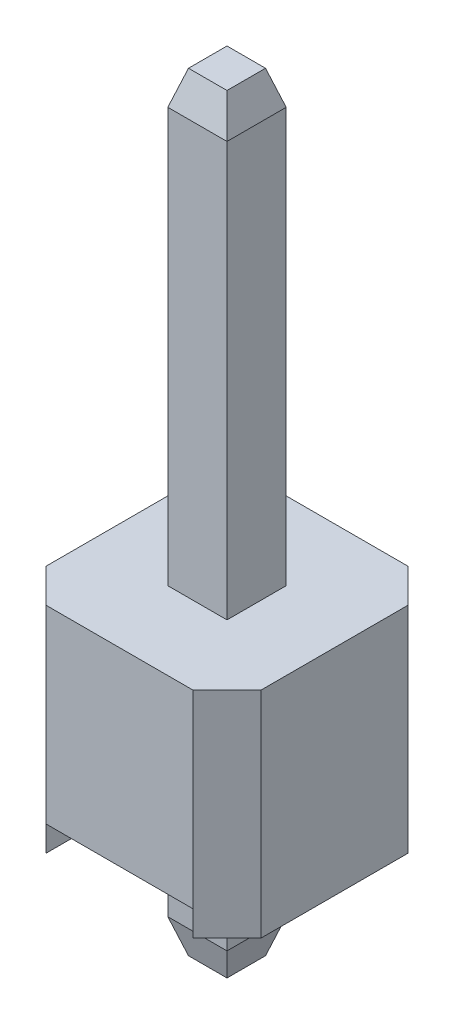
from build123d import *
from OCP.BRepFilletAPI import BRepFilletAPI_MakeChamfer

# Parameters (mm, degrees)
SKETCH1_W           = 2.54
SKETCH1_H           = 2.54
BOSS_EXTRUDE1_DEPTH = 2.54
CHAMFER1_SIZE       = 0.4
SKETCH2_W           = 1.74
SKETCH2_H           = 2.54
CUT_EXTRUDE1_DEPTH  = 0.3
SKETCH3_W           = 0.7
SKETCH3_H           = 0.7
BOSS_EXTRUDE2_DEPTH = 5.3
SKETCH4_W           = 0.7
SKETCH4_H           = 0.7
BOSS_EXTRUDE3_DEPTH = 1.55
CHAMFER2_SIZE       = 0.4
CHAMFER2_SIZE2      = 0.122292273


with BuildPart() as part:
    # Sketch1 → Boss-Extrude1 (new body)
    with BuildSketch(Plane(origin=(0, 0, 0), x_dir=(1, 0, 0), z_dir=(0, 1, 0))):
        Rectangle(SKETCH1_W, SKETCH1_H)
    extrude(amount=BOSS_EXTRUDE1_DEPTH)

    # Chamfer1
    chamfer1_edges = [part.edges().sort_by_distance(p)[0] for p in [
        (-1.27, 1.27, -1.27),
        (1.27, 1.27, -1.27),
        (-1.27, 1.27, 1.27),
        (1.27, 1.27, 1.27),
    ]]
    chamfer(chamfer1_edges, length=CHAMFER1_SIZE)

    # Sketch2 → Cut-Extrude1 (cut)
    with BuildSketch(Plane.XZ):
        Rectangle(SKETCH2_W, SKETCH2_H)
    extrude(amount=-CUT_EXTRUDE1_DEPTH, mode=Mode.SUBTRACT)

    # Sketch3 → Boss-Extrude2 (add)
    with BuildSketch(Plane(origin=(0, 2.54, 0), x_dir=(1, 0, 0), z_dir=(0, 1, 0))):
        Rectangle(SKETCH3_W, SKETCH3_H)
    extrude(amount=BOSS_EXTRUDE2_DEPTH)

    # Sketch4 → Boss-Extrude3 (add)
    with BuildSketch(Plane.XZ.offset(-0.3)):
        Rectangle(SKETCH4_W, SKETCH4_H)
    extrude(amount=BOSS_EXTRUDE3_DEPTH)

    # Chamfer2: one chamfer whose edges measure the first distance from different faces: ONE call of the kernel's chamfer builder (chamfer() names one face for all edges)
    chamfer2_edges_1 = [part.edges().sort_by_distance(p)[0] for p in [
        (0, 7.84, -0.35),
    ]]
    chamfer2_side_1 = [part.faces().sort_by_distance(p)[0] for p in [
        (0, 5.19, -0.35),
    ]]
    chamfer2_edges_2 = [part.edges().sort_by_distance(p)[0] for p in [
        (-0.35, 7.84, 0),
    ]]
    chamfer2_side_2 = [part.faces().sort_by_distance(p)[0] for p in [
        (-0.35, 5.19, 0),
    ]]
    chamfer2_edges_3 = [part.edges().sort_by_distance(p)[0] for p in [
        (0.35, 7.84, 0),
    ]]
    chamfer2_side_3 = [part.faces().sort_by_distance(p)[0] for p in [
        (0.35, 5.19, 0),
    ]]
    chamfer2_edges_4 = [part.edges().sort_by_distance(p)[0] for p in [
        (0, 7.84, 0.35),
    ]]
    chamfer2_side_4 = [part.faces().sort_by_distance(p)[0] for p in [
        (0, 5.19, 0.35),
    ]]
    chamfer2_edges_5 = [part.edges().sort_by_distance(p)[0] for p in [
        (0, -1.25, -0.35),
    ]]
    chamfer2_side_5 = [part.faces().sort_by_distance(p)[0] for p in [
        (0, -0.475, -0.35),
    ]]
    chamfer2_edges_6 = [part.edges().sort_by_distance(p)[0] for p in [
        (-0.35, -1.25, 0),
    ]]
    chamfer2_side_6 = [part.faces().sort_by_distance(p)[0] for p in [
        (-0.35, -0.475, 0),
    ]]
    chamfer2_edges_7 = [part.edges().sort_by_distance(p)[0] for p in [
        (0.35, -1.25, 0),
    ]]
    chamfer2_side_7 = [part.faces().sort_by_distance(p)[0] for p in [
        (0.35, -0.475, 0),
    ]]
    chamfer2_edges_8 = [part.edges().sort_by_distance(p)[0] for p in [
        (0, -1.25, 0.35),
    ]]
    chamfer2_side_8 = [part.faces().sort_by_distance(p)[0] for p in [
        (0, -0.475, 0.35),
    ]]
    chamfer2 = BRepFilletAPI_MakeChamfer(part.part.solid().wrapped)
    for e in chamfer2_edges_1:
        chamfer2.Add(CHAMFER2_SIZE, CHAMFER2_SIZE2, e.wrapped, chamfer2_side_1[0].wrapped)  # the first distance lies on this face
    for e in chamfer2_edges_2:
        chamfer2.Add(CHAMFER2_SIZE, CHAMFER2_SIZE2, e.wrapped, chamfer2_side_2[0].wrapped)  # the first distance lies on this face
    for e in chamfer2_edges_3:
        chamfer2.Add(CHAMFER2_SIZE, CHAMFER2_SIZE2, e.wrapped, chamfer2_side_3[0].wrapped)  # the first distance lies on this face
    for e in chamfer2_edges_4:
        chamfer2.Add(CHAMFER2_SIZE, CHAMFER2_SIZE2, e.wrapped, chamfer2_side_4[0].wrapped)  # the first distance lies on this face
    for e in chamfer2_edges_5:
        chamfer2.Add(CHAMFER2_SIZE, CHAMFER2_SIZE2, e.wrapped, chamfer2_side_5[0].wrapped)  # the first distance lies on this face
    for e in chamfer2_edges_6:
        chamfer2.Add(CHAMFER2_SIZE, CHAMFER2_SIZE2, e.wrapped, chamfer2_side_6[0].wrapped)  # the first distance lies on this face
    for e in chamfer2_edges_7:
        chamfer2.Add(CHAMFER2_SIZE, CHAMFER2_SIZE2, e.wrapped, chamfer2_side_7[0].wrapped)  # the first distance lies on this face
    for e in chamfer2_edges_8:
        chamfer2.Add(CHAMFER2_SIZE, CHAMFER2_SIZE2, e.wrapped, chamfer2_side_8[0].wrapped)  # the first distance lies on this face
    add(Compound.cast(chamfer2.Shape()), mode=Mode.REPLACE)


solid = part.part
